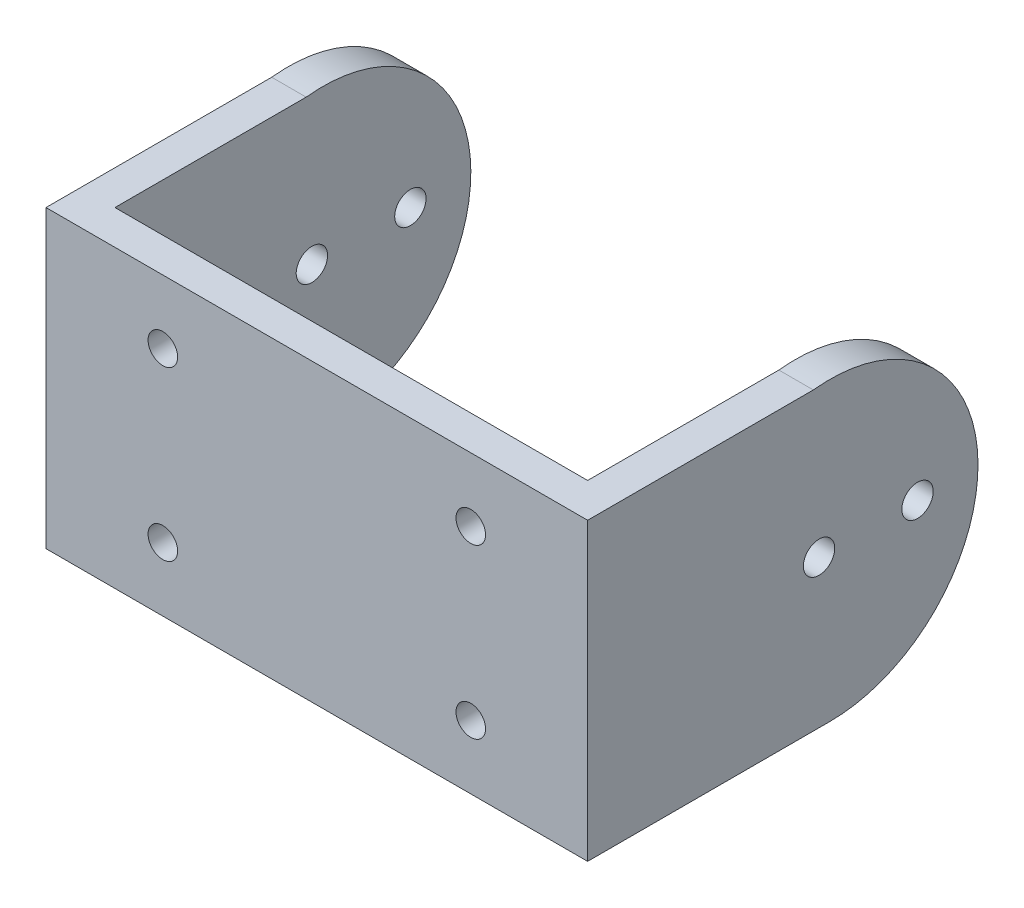
from build123d import *

# Parameters (mm, degrees)
SKETCH_1_W      = 55
SKETCH_1_H      = 30
SKETCH_1_R      = 1.5
EXTRUDE_1_DEPTH = 3.5
SKETCH_2_R      = 1.592723526
EXTRUDE_2_DEPTH = 3.5


with BuildPart() as part:
    # 草图1 → 凸台-拉伸1 (new body)
    with BuildSketch(Plane.XY):
        Rectangle(SKETCH_1_W, SKETCH_1_H)
        with Locations((15.634746474, 8.528043531)):
            Circle(SKETCH_1_R, mode=Mode.SUBTRACT)
        with Locations((-15.634746474, 8.528043531)):
            Circle(SKETCH_1_R, mode=Mode.SUBTRACT)
        with Locations((15.634746474, -8.528043531)):
            Circle(SKETCH_1_R, mode=Mode.SUBTRACT)
        with Locations((-15.634746474, -8.528043531)):
            Circle(SKETCH_1_R, mode=Mode.SUBTRACT)
    extrude(amount=EXTRUDE_1_DEPTH)

    # 草图2 → 凸台-拉伸2 (add)
    with BuildSketch(Plane(origin=(27.5, 0, 0), x_dir=(0, 0, -1), z_dir=(1, 0, 0))):
        with BuildLine():
            Line((0, 15), (0, -15))
            Line((0, -15), (21, -15))
            ThreePointArc((21, -15), (36.119015722, 0.838004237), (19.419767517, 15))
            Line((19.419767517, 15), (0, 15))
        make_face()
        with Locations((20, 0)):
            Circle(SKETCH_2_R, mode=Mode.SUBTRACT)
        with Locations((30, 0)):
            Circle(SKETCH_2_R, mode=Mode.SUBTRACT)
    extrude_2 = extrude(amount=-EXTRUDE_2_DEPTH)

    # 镜向1: 凸台-拉伸2 across plane
    add(extrude_2.mirror(Plane(origin=(0, 0, 0), x_dir=(0, 0, 1), z_dir=(1, 0, 0))))


solid = part.part
